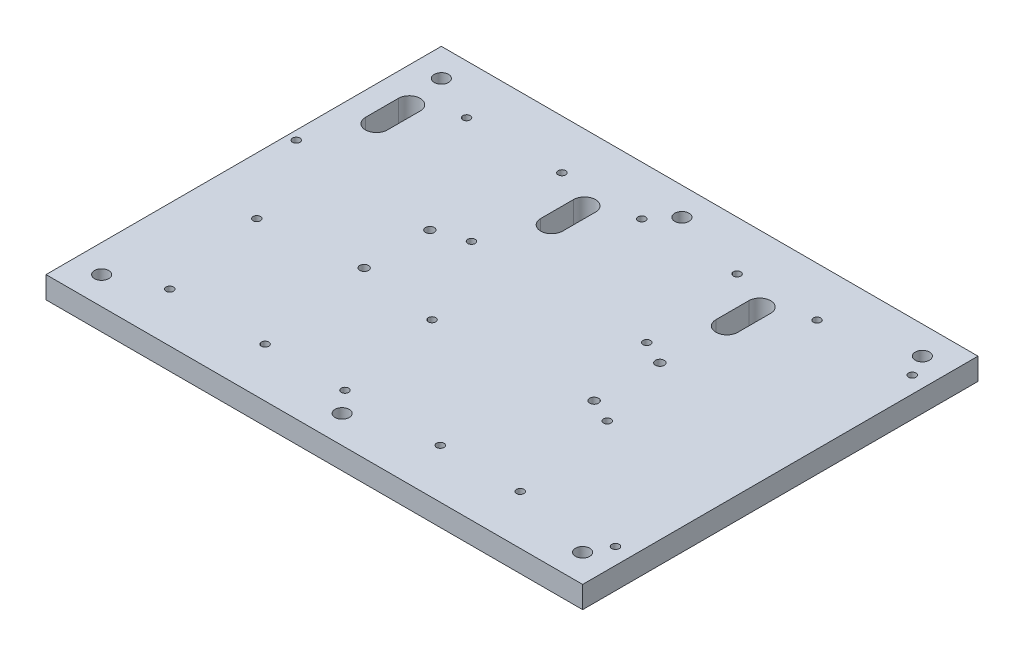
from build123d import *

# Parameters (mm, degrees)
SKETCH1_W           = 245
SKETCH1_H           = 180.5
BOSS_EXTRUDE1_DEPTH = 10
SKETCH1_5_R         = 1.7
CUT_EXTRUDE2_DEPTH  = 153.483810616
SKETCH2_W           = 120
SKETCH2_H           = 6
BOSS_EXTRUDE3_DEPTH = 30
SKETCH3_W           = 120
SKETCH3_H           = 9
BOSS_EXTRUDE4_DEPTH = 20
SKETCH4_R           = 2
CUT_EXTRUDE4_DEPTH  = 156.084855805
SKETCH7_R           = 3.25
CUT_EXTRUDE5_DEPTH  = 156.084855805
SKETCH9_R           = 1.7
CUT_EXTRUDE6_DEPTH  = 158.325498569


with BuildPart() as part:
    # Sketch1 → Boss-Extrude1 (new body)
    with BuildSketch(Plane(origin=(0, 0, 0), x_dir=(1, 0, 0), z_dir=(0, 1, 0))):
        Rectangle(SKETCH1_W, SKETCH1_H)
    extrude(amount=-BOSS_EXTRUDE1_DEPTH)

    # Sketch1<5> → Cut-Extrude2 (cut, through all)
    with BuildSketch(Plane(origin=(0, 0, 0), x_dir=(1, 0, 0), z_dir=(0, 1, 0))):
        with Locations((-88.5, 67.75)):
            Circle(SKETCH1_5_R)
        with Locations((-88.5, -67.75)):
            Circle(SKETCH1_5_R)
        with Locations((-45, -67.75)):
            Circle(SKETCH1_5_R)
        with Locations((-45, 67.75)):
            Circle(SKETCH1_5_R)
        with Locations((-8.5, 67.75)):
            Circle(SKETCH1_5_R)
        with Locations((-8.5, -67.75)):
            Circle(SKETCH1_5_R)
        with Locations((35, -67.75)):
            Circle(SKETCH1_5_R)
        with Locations((35, 67.75)):
            Circle(SKETCH1_5_R)
        with Locations((71.5, 67.75)):
            Circle(SKETCH1_5_R)
        with Locations((71.5, -67.75)):
            Circle(SKETCH1_5_R)
        with Locations((115, -67.75)):
            Circle(SKETCH1_5_R)
        with Locations((115, 67.75)):
            Circle(SKETCH1_5_R)
    extrude(amount=-CUT_EXTRUDE2_DEPTH, mode=Mode.SUBTRACT)

    # Sketch2 → Boss-Extrude3 (add)
    with BuildSketch(Plane.XZ.offset(10)):
        Rectangle(SKETCH2_W, SKETCH2_H)
    extrude(amount=BOSS_EXTRUDE3_DEPTH)

    # Sketch3 → Boss-Extrude4 (add)
    with BuildSketch(Plane.XZ.offset(10)):
        Rectangle(SKETCH3_W, SKETCH3_H)
    extrude(amount=BOSS_EXTRUDE4_DEPTH)

    # Sketch4 → Cut-Extrude4 (cut, through all)
    with BuildSketch(Plane.XZ.offset(10)):
        with Locations((-52.5, 15)):
            Circle(SKETCH4_R)
        with Locations((52.5, 15)):
            Circle(SKETCH4_R)
        with Locations((52.5, -15)):
            Circle(SKETCH4_R)
        with Locations((-52.5, -15)):
            Circle(SKETCH4_R)
    extrude(amount=-CUT_EXTRUDE4_DEPTH, mode=Mode.SUBTRACT)

    # Sketch7 → Cut-Extrude5 (cut, through all)
    with BuildSketch(Plane.XZ.offset(10)):
        with Locations((-109.8, 77.55)):
            Circle(SKETCH7_R)
        with Locations((0, 77.55)):
            Circle(SKETCH7_R)
        with Locations((109.8, 77.55)):
            Circle(SKETCH7_R)
        with Locations((-109.8, -77.55)):
            Circle(SKETCH7_R)
        with Locations((0, -77.55)):
            Circle(SKETCH7_R)
        with Locations((109.8, -77.55)):
            Circle(SKETCH7_R)
    extrude(amount=-CUT_EXTRUDE5_DEPTH, mode=Mode.SUBTRACT)

    # Sketch9 → Cut-Extrude6 (cut, through all)
    with BuildSketch(Plane(origin=(0, 0, 0), x_dir=(1, 0, 0), z_dir=(0, 1, 0))):
        with Locations((41.5, 20)):
            Circle(SKETCH9_R)
        with Locations((63.5, -20)):
            Circle(SKETCH9_R)
        with Locations((-38.5, 20)):
            Circle(SKETCH9_R)
        with Locations((-16.5, -20)):
            Circle(SKETCH9_R)
        with Locations((-118.5, 20)):
            Circle(SKETCH9_R)
        with Locations((-96.5, -20)):
            Circle(SKETCH9_R)
        with BuildLine():
            Line((58.25, 59.85), (58.25, 44.85))
            ThreePointArc((58.25, 44.85), (53.25, 39.85), (48.25, 44.85))
            Line((48.25, 44.85), (48.25, 59.85))
            ThreePointArc((48.25, 59.85), (53.25, 64.85), (58.25, 59.85))
        make_face()
        with BuildLine():
            Line((-21.75, 59.85), (-21.75, 44.85))
            ThreePointArc((-21.75, 44.85), (-26.75, 39.85), (-31.75, 44.85))
            Line((-31.75, 44.85), (-31.75, 59.85))
            ThreePointArc((-31.75, 59.85), (-26.75, 64.85), (-21.75, 59.85))
        make_face()
        with BuildLine():
            Line((-101.75, 59.85), (-101.75, 44.85))
            ThreePointArc((-101.75, 44.85), (-106.75, 39.85), (-111.75, 44.85))
            Line((-111.75, 44.85), (-111.75, 59.85))
            ThreePointArc((-111.75, 59.85), (-106.75, 64.85), (-101.75, 59.85))
        make_face()
    extrude(amount=-CUT_EXTRUDE6_DEPTH, mode=Mode.SUBTRACT)


solid = part.part
